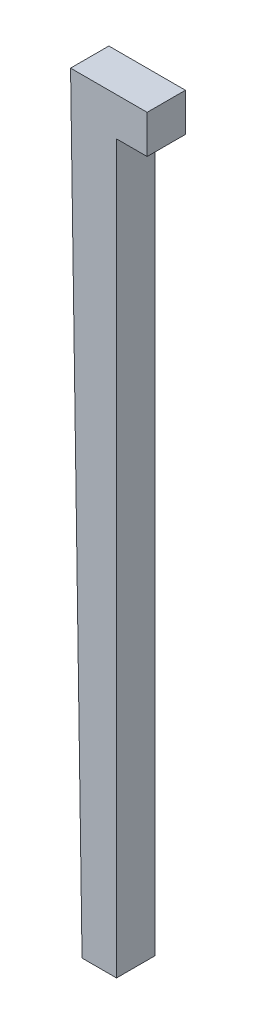
from build123d import *

# Parameters (mm, degrees)
LOFT3_START         = -2.5
LOFT3_DEPTH         = 5
SKETCH7_W           = 4
SKETCH7_H           = 5
BOSS_EXTRUDE1_DEPTH = 5


# Read off the part's stored shape, not the designer's step: Loft3
with BuildPart() as part:
    # Loft3 outline → Loft3 (new body)
    with BuildSketch(Plane.XY.offset(LOFT3_START)):
        Polygon((5.008763306, -99.9), (9.508763306, -99.9), (9.508763306, 0), (3.508763306, 0), align=None)
    extrude(amount=LOFT3_DEPTH)

    # Sketch7 → Boss-Extrude1 (add)
    with BuildSketch(Plane.XY.offset(2.5)):
        with Locations((11.508763306, -2.5)):
            Rectangle(SKETCH7_W, SKETCH7_H)
    extrude(amount=-BOSS_EXTRUDE1_DEPTH)


solid = part.part
